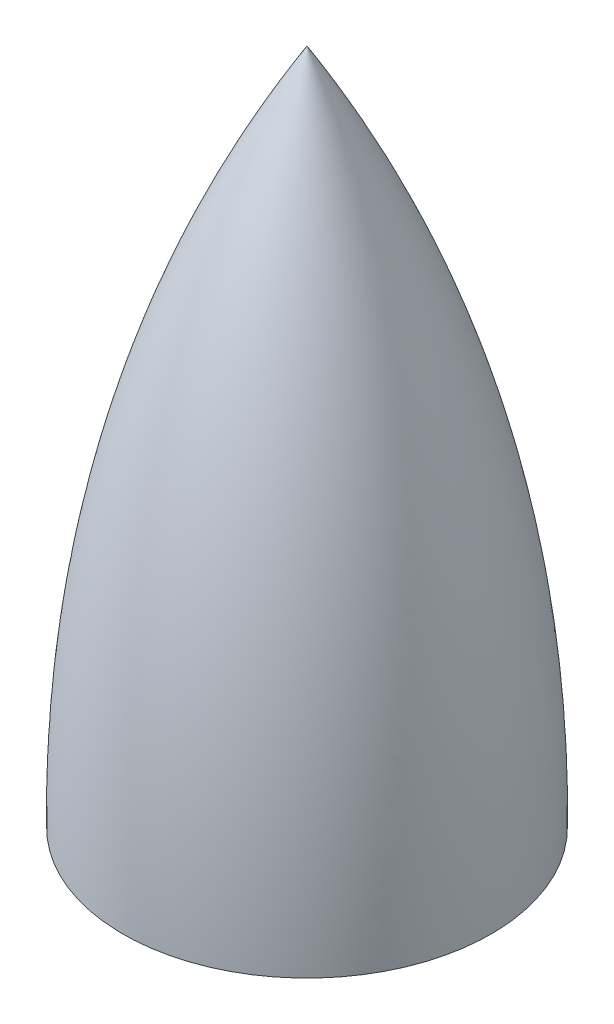
from build123d import *


with BuildPart() as part:
    # Sketch2 → Revolve2 (revolve)
    with BuildSketch(Plane.XY):
        with BuildLine():
            Line((-101.6, 0), (-107.95, 0))
            add(Edge.make_bspline(
                [(-107.95, 0), (-109.972594743, 215.178686236), (0, 396.861364613)],
                knots=[0, 0, 0, 1, 1, 1], degree=2))
            Line((0, 396.861364613), (0, 393.686364613))
            add(Edge.make_bspline(
                [(-101.6, 0), (-107.046011686, 212.987606476), (0, 393.686364613)],
                knots=[0, 0, 0, 1, 1, 1], degree=2))
        make_face()
    revolve(axis=Axis((0, 0, 0), (0, 1, 0)))


solid = part.part
